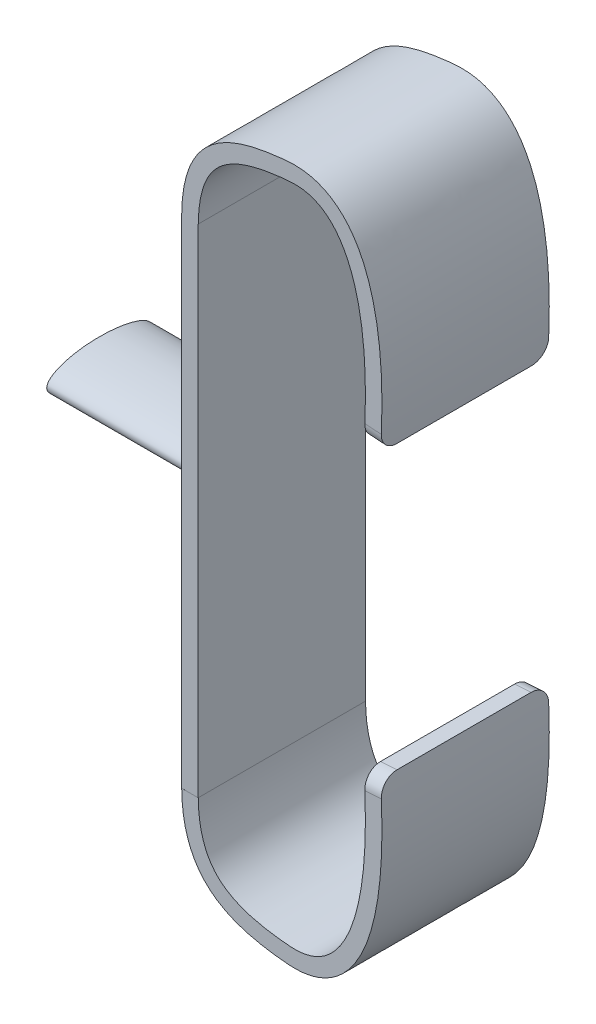
from build123d import *

# Parameters (mm, degrees)
EXTRUDE_THIN1_DEPTH   = 25.654
EXTRUDE_THIN1_2_DEPTH = 25.654
SKETCH4_RX            = 8.120921881
SKETCH4_RY            = 2.774524796
BOSS_EXTRUDE1_DEPTH   = 25.4
SKETCH5_RX            = 6.565465979
SKETCH5_RY            = 1.905
CUT_EXTRUDE1_DEPTH    = 22.86
FILLET1_R             = 2.54
FILLET2_R             = 2.54


# Read off the part's stored shape, not the designer's step: Extrude-Thin1
with BuildPart() as part:
    # Extrude-Thin1 outline → Extrude-Thin1 (new body)
    with BuildSketch(Plane.XY):
        with BuildLine():
            Line((30.48, -21.66914096), (27.945531504, -21.836680329))
            add(Edge.make_bspline(
                [(27.945531504, -21.836680329), (28.216439415, -25.93486673), (28.23252486, -29.479469819), (27.872267932, -35.583082717), (27.495669128, -38.141627179), (26.481717741, -42.397642841), (25.844975686, -44.093807332), (24.457217637, -46.778355936), (23.709075743, -47.767064676), (22.209275028, -49.249054272), (21.456334771, -49.746827821), (19.965368397, -50.441349655), (19.225863185, -50.636243836), (17.786990757, -50.824907544), (17.07083353, -50.820409838), (16.095443713, -50.745282939), (15.896649021, -50.726788865), (15.490503236, -50.684553576), (15.281414749, -50.660661788), (14.653166379, -50.585312237), (14.238591647, -50.53015824), (12.194702947, -50.223727073), (10.654009092, -49.877340199), (8.625229356, -49.123559812), (7.995829874, -48.834151782), (6.840720894, -48.169639667), (6.314943902, -47.795162364), (5.360454433, -46.940512269), (4.930828424, -46.460464413), (4.158987377, -45.347819896), (3.816278634, -44.714238293), (3.232884788, -43.233869293), (2.992795748, -42.386537786), (2.651749825, -40.433365024), (2.551277196, -39.327787262), (2.539894361, -38.079751671)],
                knots=[0, 0, 0, 0, 0.0625, 0.0625, 0.125, 0.125, 0.1875, 0.1875, 0.25, 0.25, 0.3125, 0.3125, 0.375, 0.375, 0.4375, 0.4375, 0.453125, 0.453125, 0.46875, 0.46875, 0.5, 0.5, 0.625, 0.625, 0.6875, 0.6875, 0.75, 0.75, 0.8125, 0.8125, 0.875, 0.875, 0.9375, 0.9375, 1, 1, 1, 1], degree=3))
            Line((2.539894361, -38.079751671), (0, -38.102917034))
            add(Edge.make_bspline(
                [(30.48, -21.66914096), (32.097084155, -46.13174249), (22.932616936, -53.850579007), (8.743728035, -52.754122664), (0.106968945, -49.831194873), (0, -38.102917034)],
                knots=[0, 0, 0, 0, 0.365105408, 0.465105408, 1, 1, 1, 1], degree=3))
        make_face()
    extrude(amount=EXTRUDE_THIN1_DEPTH)

    # Fillet2
    fillet2_edges = [part.edges().sort_by_distance(p)[0] for p in [
        (29.212765752, -21.752910644, 25.654),
        (29.212765752, -21.752910644, 0),
    ]]
    fillet(fillet2_edges, radius=FILLET2_R)


with BuildPart() as body_2:
    # Extrude-Thin1 2 outline → Extrude-Thin1 2 (new body)
    with BuildSketch(Plane.XY):
        with BuildLine():
            Line((2.54, -38.097082966), (2.54, 38.097082966))
            add(Edge.make_bspline(
                [(2.54, 38.097082966), (2.55247561, 39.342882783), (2.653861042, 40.44639958), (2.996393497, 42.395844424), (3.237054423, 43.241511707), (3.821349871, 44.719012561), (4.164392201, 45.351394795), (4.936827462, 46.462062079), (5.366719378, 46.941327746), (6.321733103, 47.794653487), (6.847764322, 48.168583404), (8.003299385, 48.832110701), (8.632867302, 49.121083114), (10.66193968, 49.873691678), (12.202532613, 50.219488822), (14.245995135, 50.525427878), (14.660470529, 50.580495346), (15.288551787, 50.655731835), (15.497412831, 50.67956491), (15.903211301, 50.721667454), (16.10184127, 50.740086851), (17.076455676, 50.814812135), (17.792148896, 50.818917668), (19.230547776, 50.629398095), (19.96987556, 50.434038624), (21.460319225, 49.738590728), (22.212989851, 49.240331772), (23.712183679, 47.757387511), (24.45997348, 46.768216796), (25.846937805, 44.083068815), (26.483244577, 42.386773153), (27.496414466, 38.131062208), (27.872669783, 35.572950748), (28.232498094, 29.470917951), (28.216327109, 25.927460772), (27.945531504, 21.830846261)],
                knots=[0, 0, 0, 0, 0.0625, 0.0625, 0.125, 0.125, 0.1875, 0.1875, 0.25, 0.25, 0.3125, 0.3125, 0.375, 0.375, 0.5, 0.5, 0.53125, 0.53125, 0.546875, 0.546875, 0.5625, 0.5625, 0.625, 0.625, 0.6875, 0.6875, 0.75, 0.75, 0.8125, 0.8125, 0.875, 0.875, 0.9375, 0.9375, 1, 1, 1, 1], degree=3))
            Line((27.945531504, 21.830846261), (30.48, 21.663306891))
            add(Edge.make_bspline(
                [(0, 38.097082966), (0.106968945, 49.825360805), (8.743728035, 52.748288596), (22.932616936, 53.844744939), (32.097084155, 46.125908422), (30.48, 21.663306891)],
                knots=[0, 0, 0, 0, 0.534894592, 0.634894592, 1, 1, 1, 1], degree=3))
            Line((0, 38.097082966), (0, -38.097082966))
            Line((0, -38.097082966), (2.54, -38.097082966))
        make_face()
    extrude(amount=EXTRUDE_THIN1_2_DEPTH)

    # Sketch4 → Boss-Extrude1 (add)
    with BuildSketch(Plane.ZY):
        with Locations((12.827, 0)):
            Ellipse(SKETCH4_RX, SKETCH4_RY)
    extrude(amount=BOSS_EXTRUDE1_DEPTH)

    # Sketch5 → Cut-Extrude1 (cut)
    with BuildSketch(Plane.ZY.offset(25.4)):
        with Locations((12.827, 0)):
            Ellipse(SKETCH5_RX, SKETCH5_RY)
    extrude(amount=-CUT_EXTRUDE1_DEPTH, mode=Mode.SUBTRACT)

    # Fillet1
    fillet1_edges = [body_2.edges().sort_by_distance(p)[0] for p in [
        (29.212765752, 21.747076576, 0),
        (29.212765752, 21.747076576, 25.654),
    ]]
    fillet(fillet1_edges, radius=FILLET1_R)


solid = Compound([part.part, body_2.part])
